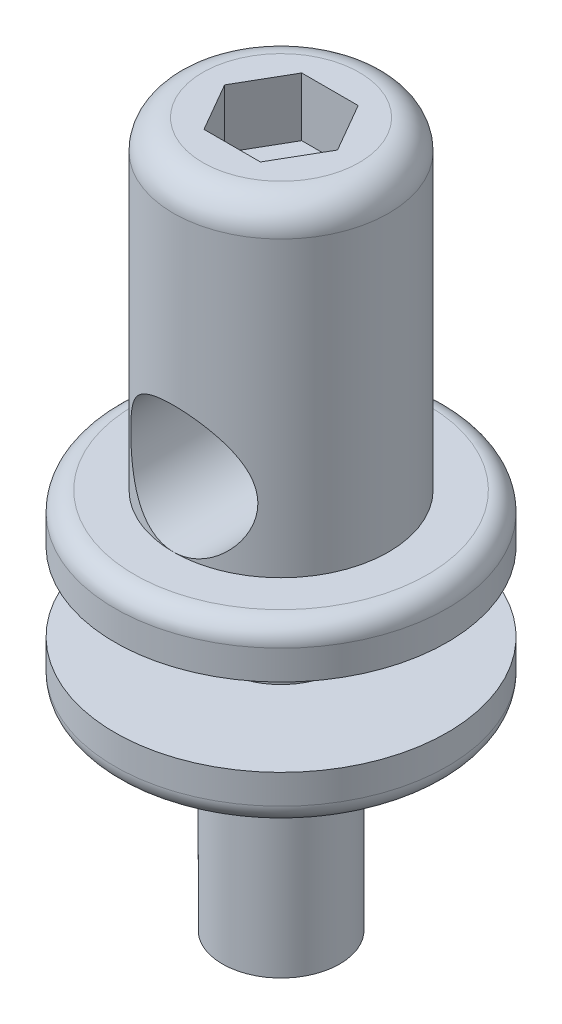
from build123d import *

# Parameters (mm, degrees)
SCHIZZO1_R                    = 5.5
ESTRUSIONE1_DEPTH             = 19
SCHIZZO2_R                    = 3
ESTRUSIONE2_DEPTH             = 17
TAGLIO_ESTRUSIONE1_DEPTH      = 3
RACCORDO1_R                   = 1.5
TAGLIO_ESTRUSIONE2_DEPTH      = 21.530465168
TAGLIO_ESTRUSIONE2_DEPTH_BACK = 21.530465168
SCHIZZO4_R                    = 3.25
SCHIZZO5_R                    = 8.5
SCHIZZO5_R_2                  = 5.5
ESTRUSIONE3_DEPTH             = 2.5
RACCORDO2_R                   = 1
SCHIZZO6_R                    = 8.5
SCHIZZO6_R_2                  = 3
ESTRUSIONE4_DEPTH             = 2.5
RACCORDO3_R                   = 1


with BuildPart() as part:
    # Schizzo1 → Estrusione1 (new body)
    with BuildSketch(Plane(origin=(0, 0, 0), x_dir=(1, 0, 0), z_dir=(0, 1, 0))):
        Circle(SCHIZZO1_R)
    extrude(amount=ESTRUSIONE1_DEPTH)

    # Schizzo2 → Estrusione2 (add)
    with BuildSketch(Plane.XZ):
        Circle(SCHIZZO2_R)
    extrude(amount=ESTRUSIONE2_DEPTH)

    # Schizzo3 → Taglio-Estrusione1 (cut)
    with BuildSketch(Plane(origin=(0, 19, 0), x_dir=(-1, 0, 0), z_dir=(0, 1, 0))):
        Polygon((-2.886751346, 0), (-1.443375673, -2.5), (1.443375673, -2.5), (2.886751346, 0), (1.443375673, 2.5), (-1.443375673, 2.5), align=None)
    extrude(amount=-TAGLIO_ESTRUSIONE1_DEPTH, mode=Mode.SUBTRACT)

    # Raccordo1
    raccordo1_edges = [part.edges().sort_by_distance(p)[0] for p in [
        (-5.5, 19, 0),
    ]]
    fillet(raccordo1_edges, radius=RACCORDO1_R)

    # Schizzo4 → Taglio-Estrusione2 (cut, two sides: drawn at the far end of the back side and taken through both)
    with BuildSketch(Plane.XY.offset(-TAGLIO_ESTRUSIONE2_DEPTH_BACK)):
        with Locations((0, 5.75)):
            Circle(SCHIZZO4_R)
    extrude(amount=TAGLIO_ESTRUSIONE2_DEPTH + TAGLIO_ESTRUSIONE2_DEPTH_BACK, mode=Mode.SUBTRACT)


with BuildPart() as body_2:
    # Schizzo5 → Estrusione3 (new body)
    with BuildSketch(Plane.XZ):
        Circle(SCHIZZO5_R)
        Circle(SCHIZZO5_R_2, mode=Mode.SUBTRACT)
    extrude(amount=-ESTRUSIONE3_DEPTH)

    # Raccordo2
    raccordo2_edges = [body_2.edges().sort_by_distance(p)[0] for p in [
        (-8.5, 2.5, 0),
    ]]
    fillet(raccordo2_edges, radius=RACCORDO2_R)


with BuildPart() as body_3:
    # Schizzo6 → Estrusione4 (new body)
    with BuildSketch(Plane.XZ.offset(4)):
        Circle(SCHIZZO6_R)
        Circle(SCHIZZO6_R_2, mode=Mode.SUBTRACT)
    extrude(amount=ESTRUSIONE4_DEPTH)

    # Raccordo3
    raccordo3_edges = [body_3.edges().sort_by_distance(p)[0] for p in [
        (-8.5, -6.5, 0),
    ]]
    fillet(raccordo3_edges, radius=RACCORDO3_R)


solid = Compound([part.part, body_2.part, body_3.part])
